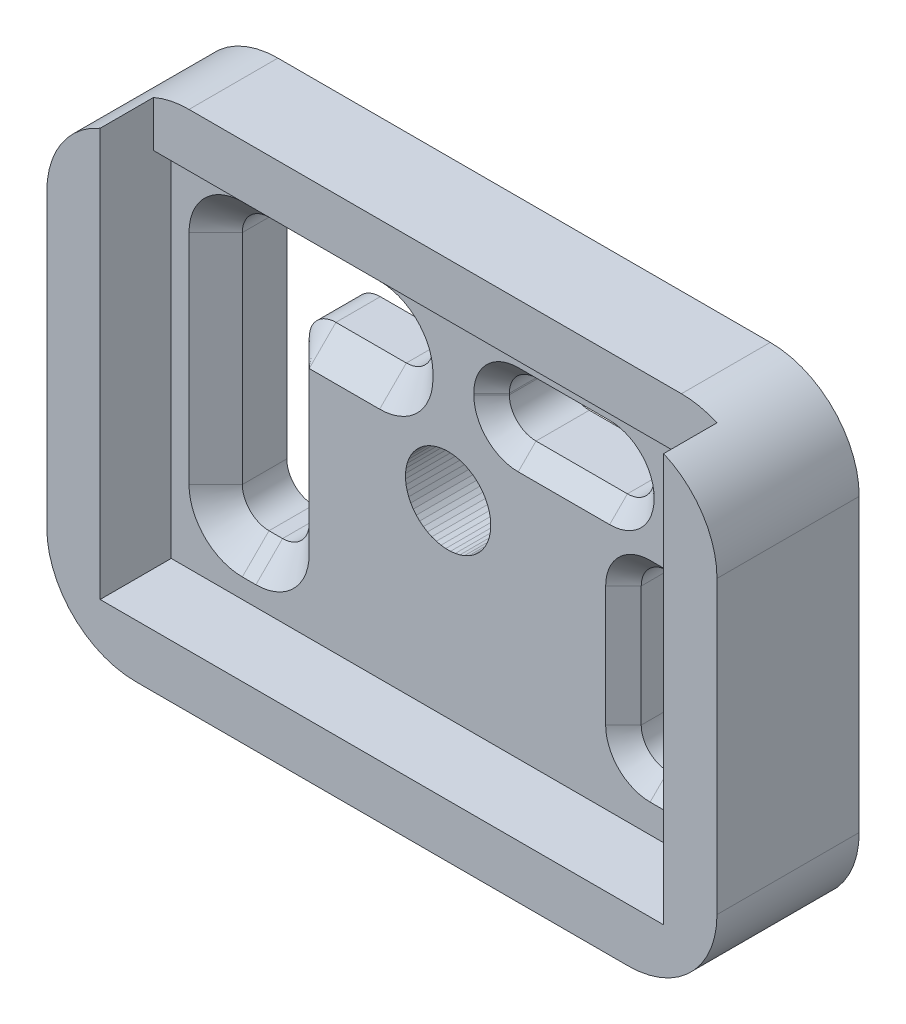
from build123d import *

# Parameters (mm, degrees)
MODEL_W                      = 31.7
MODEL_H                      = 20.375
SALIENTE_EXTRUIR1_DEPTH      = 4
SALIENTE_EXTRUIR2_DEPTH      = 4
SALIENTE_EXTRUIR2_DEPTH_BACK = 4
CROQUIS3_W                   = 37.7
CROQUIS3_H                   = 26.375
CROQUIS3_W_2                 = 31.7
CROQUIS3_H_2                 = 20.375
REDONDEO1_R                  = 5
REDONDEO3_R                  = 5
CROQUIS8_W                   = 31.7
CROQUIS8_H                   = 3.000145556
CORTAR_EXTRUIR2_DEPTH        = 4
CORTAR_EXTRUIR3_DEPTH        = 4
CHAFL_N3_SIZE                = 1.5
CHAFL_N4_SIZE                = 1


with BuildPart() as part:
    # Model → Saliente-Extruir1 (new body)
    with BuildSketch(Plane.XY):
        with Locations((126.95, -64.0625)):
            Rectangle(MODEL_W, MODEL_H)
        Polygon((126.809569, -61.253776), (127.077015, -61.28391), (127.339405, -61.343798), (127.59344, -61.432689), (127.835925, -61.549464), (128.063811, -61.692654), (128.274232, -61.860459), (128.464541, -62.050768), (128.632346, -62.261189), (128.775536, -62.489075), (128.892311, -62.73156), (128.981202, -62.985595), (129.04109, -63.247985), (129.071224, -63.515431), (129.071224, -63.784569), (129.04109, -64.052015), (128.981202, -64.314405), (128.892311, -64.56844), (128.775536, -64.810925), (128.632346, -65.038811), (128.464541, -65.249232), (128.274232, -65.439541), (128.063811, -65.607346), (127.835925, -65.750536), (127.59344, -65.867311), (127.339405, -65.956202), (127.077015, -66.01609), (126.809569, -66.046224), (126.540431, -66.046224), (126.272985, -66.01609), (126.010595, -65.956202), (125.75656, -65.867311), (125.514075, -65.750536), (125.286189, -65.607346), (125.075768, -65.439541), (124.885459, -65.249232), (124.717654, -65.038811), (124.574464, -64.810925), (124.457689, -64.56844), (124.368798, -64.314405), (124.30891, -64.052015), (124.278776, -63.784569), (124.278776, -63.515431), (124.279861, -63.505804), (124.30891, -63.247985), (124.368798, -62.985595), (124.457689, -62.73156), (124.574464, -62.489075), (124.717654, -62.261189), (124.885459, -62.050768), (125.075768, -61.860459), (125.286189, -61.692654), (125.514075, -61.549464), (125.75656, -61.432689), (126.010595, -61.343798), (126.272985, -61.28391), (126.540431, -61.253776), align=None, mode=Mode.SUBTRACT)
    extrude(amount=SALIENTE_EXTRUIR1_DEPTH)

    # Croquis3 → Saliente-Extruir2 (add, two sides: drawn at the far end of the back side and taken through both)
    with BuildSketch(Plane.XY.offset(4).offset(-SALIENTE_EXTRUIR2_DEPTH_BACK)):
        with Locations((126.95, -64.0625)):
            Rectangle(CROQUIS3_W, CROQUIS3_H)
        with Locations((126.95, -64.0625)):
            Rectangle(CROQUIS3_W_2, CROQUIS3_H_2, mode=Mode.SUBTRACT)
    extrude(amount=SALIENTE_EXTRUIR2_DEPTH + SALIENTE_EXTRUIR2_DEPTH_BACK)

    # Redondeo1
    redondeo1_edges = [part.edges().sort_by_distance(p)[0] for p in [
        (108.1, -77.25, 4),
        (145.8, -77.25, 4),
    ]]
    fillet(redondeo1_edges, radius=REDONDEO1_R)

    # Redondeo3
    redondeo3_edges = [part.edges().sort_by_distance(p)[0] for p in [
        (145.8, -50.875, 4),
        (108.1, -50.875, 4),
    ]]
    fillet(redondeo3_edges, radius=REDONDEO3_R)

    # Croquis8 → Cortar-Extruir2 (cut)
    with BuildSketch(Plane.XZ.offset(53.875)):
        with Locations((126.95, 6.499927222)):
            Rectangle(CROQUIS8_W, CROQUIS8_H)
    extrude(amount=-CORTAR_EXTRUIR2_DEPTH, mode=Mode.SUBTRACT)

    # Croquis9 → Cortar-Extruir3 (cut)
    with BuildSketch(Plane.XY.offset(4)):
        with BuildLine():
            Line((115.1, -56.375), (118.625993534, -56.375))
            Line((118.625993534, -56.375), (122.824085816, -56.375))
            ThreePointArc((122.824085816, -56.375), (123.884745987, -56.814339828), (124.324085816, -57.875))
            Line((124.324085816, -57.875), (124.324085816, -58.116279303))
            ThreePointArc((124.324085816, -58.116279303), (123.884745987, -59.176939475), (122.824085816, -59.616279303))
            Line((122.824085816, -59.616279303), (118.862646904, -59.616279303))
            ThreePointArc((118.862646904, -59.616279303), (117.801986732, -60.055619131), (117.362646904, -61.116279303))
            Line((117.362646904, -61.116279303), (117.362646904, -70.15))
            ThreePointArc((117.362646904, -70.15), (116.923307076, -71.210660172), (115.862646904, -71.65))
            Line((115.862646904, -71.65), (115.1, -71.65))
            ThreePointArc((115.1, -71.65), (114.039339828, -71.210660172), (113.6, -70.15))
            Line((113.6, -70.15), (113.6, -57.875))
            ThreePointArc((113.6, -57.875), (114.039339828, -56.814339828), (115.1, -56.375))
        make_face()
        with BuildLine():
            Line((138.8, -71.65), (138.037353096, -71.65))
            ThreePointArc((138.037353096, -71.65), (136.976692924, -71.210660172), (136.537353096, -70.15))
            Line((136.537353096, -70.15), (136.537353096, -63.375))
            ThreePointArc((136.537353096, -63.375), (136.976692924, -62.314339828), (138.037353096, -61.875))
            Line((138.037353096, -61.875), (138.8, -61.875))
            ThreePointArc((138.8, -61.875), (139.860660172, -62.314339828), (140.3, -63.375))
            Line((140.3, -63.375), (140.3, -70.15))
            ThreePointArc((140.3, -70.15), (139.860660172, -71.210660172), (138.8, -71.65))
        make_face()
        with BuildLine():
            Line((130.618924081, -56.194062707), (135.761102268, -56.194062707))
            ThreePointArc((135.761102268, -56.194062707), (136.82176244, -56.633402535), (137.261102268, -57.694062707))
            Line((137.261102268, -57.694062707), (137.261102268, -57.771184154))
            ThreePointArc((137.261102268, -57.771184154), (136.82176244, -58.831844326), (135.761102268, -59.271184154))
            Line((135.761102268, -59.271184154), (130.618924081, -59.271184154))
            ThreePointArc((130.618924081, -59.271184154), (129.55826391, -58.831844326), (129.118924081, -57.771184154))
            Line((129.118924081, -57.771184154), (129.118924081, -57.694062707))
            ThreePointArc((129.118924081, -57.694062707), (129.55826391, -56.633402535), (130.618924081, -56.194062707))
        make_face()
    extrude(amount=-CORTAR_EXTRUIR3_DEPTH, mode=Mode.SUBTRACT)

    # Chaflán3
    chafl_n3_edges = [part.edges().sort_by_distance(p)[0] for p in [
        (123.884745987, -56.814339828, 4),
        (118.962042908, -56.375, 4),
        (114.039339828, -56.814339828, 4),
        (113.6, -64.0125, 4),
        (114.039339828, -71.210660172, 4),
        (115.481323452, -71.65, 4),
        (116.923307076, -71.210660172, 4),
        (117.362646904, -65.633139651, 4),
        (117.801986732, -60.055619131, 4),
        (120.84336636, -59.616279303, 4),
        (123.884745987, -59.176939475, 4),
        (124.324085816, -57.995639651, 4),
    ]]
    chamfer(chafl_n3_edges, length=CHAFL_N3_SIZE - 0.0001)  # a hair under: the kernel refuses the full size

    # Chaflán4
    chafl_n4_edges = [part.edges().sort_by_distance(p)[0] for p in [
        (139.860660172, -71.210660172, 4),
        (140.3, -66.7625, 4),
        (139.860660172, -62.314339828, 4),
        (138.418676548, -61.875, 4),
        (136.976692924, -62.314339828, 4),
        (136.537353096, -66.7625, 4),
        (136.976692924, -71.210660172, 4),
        (138.418676548, -71.65, 4),
        (136.82176244, -58.831844326, 4),
        (137.261102268, -57.73262343, 4),
        (136.82176244, -56.633402535, 4),
        (133.190013175, -56.194062707, 4),
        (129.55826391, -56.633402535, 4),
        (129.118924081, -57.73262343, 4),
        (129.55826391, -58.831844326, 4),
        (133.190013175, -59.271184154, 4),
    ]]
    chamfer(chafl_n4_edges, length=CHAFL_N4_SIZE)


solid = part.part
